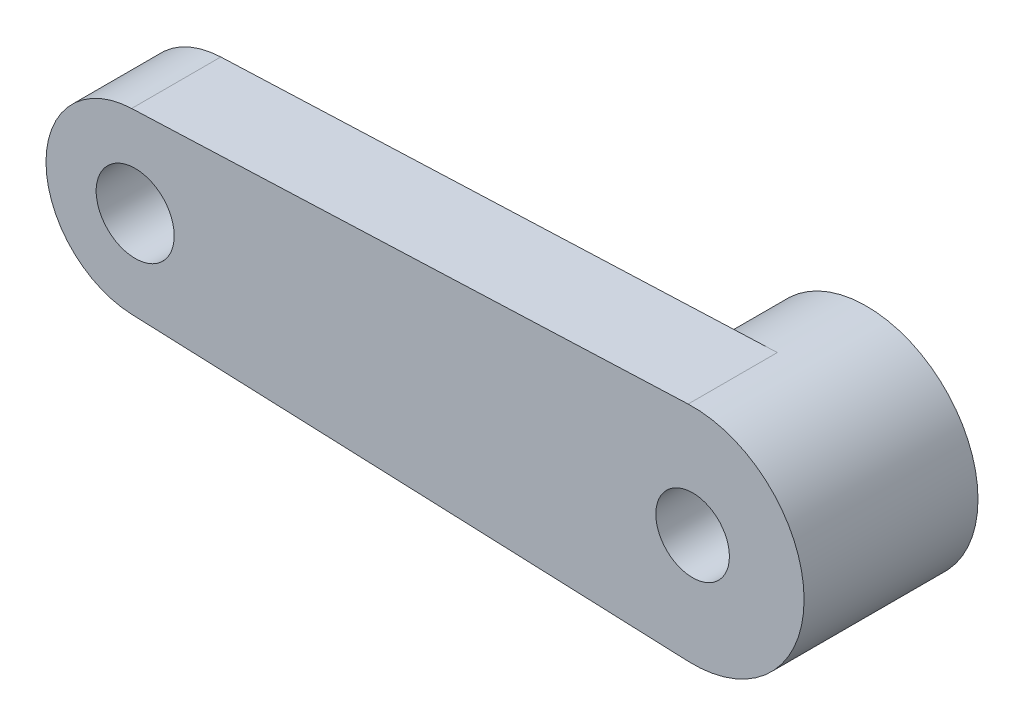
from build123d import *
from build123d.topology import SkipClean

# Parameters (mm, degrees)
SKETCH1_R           = 5
BOSS_EXTRUDE1_DEPTH = 3.8
SKETCH2_R           = 1.65
SKETCH2_R_2         = 1.75
BOSS_EXTRUDE2_DEPTH = 4


with BuildPart() as part:
    # Sketch1 → Boss-Extrude1 (new body)
    with BuildSketch(Plane.XY):
        Circle(SKETCH1_R)
        with BuildLine():
            Line((0.230810939, 2.825076686), (0.169592064, 2.745294695))
            Line((0.169592064, 2.745294695), (0.121151994, 2.829195356))
            ThreePointArc((0.121151994, 2.829195356), (-0.003908933, 2.911590561), (-0.137917489, 2.844725679))
            Line((-0.137917489, 2.844725679), (-0.190155863, 2.75424616))
            Line((-0.190155863, 2.75424616), (-0.251374738, 2.834028151))
            ThreePointArc((-0.251374738, 2.834028151), (-0.389956668, 2.891430666), (-0.508959669, 2.800116452))
            Line((-0.508959669, 2.800116452), (-0.547443463, 2.707208355))
            Line((-0.547443463, 2.707208355), (-0.618552241, 2.778317134))
            ThreePointArc((-0.618552241, 2.778317134), (-0.763441115, 2.817139991), (-0.869507132, 2.711073973))
            Line((-0.869507132, 2.711073973), (-0.895534752, 2.613937576))
            Line((-0.895534752, 2.613937576), (-0.975316743, 2.675156451))
            ThreePointArc((-0.975316743, 2.675156451), (-1.124033472, 2.694735379), (-1.215347686, 2.575732378))
            Line((-1.215347686, 2.575732378), (-1.228473792, 2.47602971))
            Line((-1.228473792, 2.47602971), (-1.315563903, 2.526311209))
            ThreePointArc((-1.315563903, 2.526311209), (-1.465563903, 2.526311209), (-1.540563903, 2.396407399))
            Line((-1.540563903, 2.396407399), (-1.540563903, 2.2958444))
            Line((-1.540563903, 2.2958444), (-1.633472, 2.334328193))
            ThreePointArc((-1.633472, 2.334328193), (-1.782188729, 2.314749265), (-1.839591244, 2.176167335))
            Line((-1.839591244, 2.176167335), (-1.826465138, 2.076464666))
            Line((-1.826465138, 2.076464666), (-1.923601536, 2.102492286))
            ThreePointArc((-1.923601536, 2.102492286), (-2.06849041, 2.063669429), (-2.107313267, 1.918780555))
            Line((-2.107313267, 1.918780555), (-2.081285648, 1.821644157))
            Line((-2.081285648, 1.821644157), (-2.180988316, 1.834770262))
            ThreePointArc((-2.180988316, 1.834770262), (-2.319570246, 1.777367747), (-2.339149175, 1.628651018))
            Line((-2.339149175, 1.628651018), (-2.300665381, 1.535742922))
            Line((-2.300665381, 1.535742922), (-2.40122838, 1.535742922))
            ThreePointArc((-2.40122838, 1.535742922), (-2.531132191, 1.460742922), (-2.531132191, 1.310742922))
            Line((-2.531132191, 1.310742922), (-2.480850691, 1.22365281))
            Line((-2.480850691, 1.22365281), (-2.58055336, 1.210526705))
            ThreePointArc((-2.58055336, 1.210526705), (-2.699556361, 1.11921249), (-2.679977432, 0.970495761))
            Line((-2.679977432, 0.970495761), (-2.618758557, 0.89071377))
            Line((-2.618758557, 0.89071377), (-2.715894955, 0.864686151))
            ThreePointArc((-2.715894955, 0.864686151), (-2.821960972, 0.758620134), (-2.783138115, 0.61373126))
            Line((-2.783138115, 0.61373126), (-2.712029337, 0.542622481))
            Line((-2.712029337, 0.542622481), (-2.804937433, 0.504138688))
            ThreePointArc((-2.804937433, 0.504138688), (-2.896251648, 0.385135687), (-2.838849133, 0.246553757))
            Line((-2.838849133, 0.246553757), (-2.759067142, 0.185334882))
            Line((-2.759067142, 0.185334882), (-2.846157253, 0.135053382))
            ThreePointArc((-2.846157253, 0.135053382), (-2.921157253, 0.005149572), (-2.846157253, -0.124754239))
            Line((-2.846157253, -0.124754239), (-2.759067142, -0.175035738))
            Line((-2.759067142, -0.175035738), (-2.838849133, -0.236254613))
            ThreePointArc((-2.838849133, -0.236254613), (-2.896251648, -0.374836543), (-2.804937433, -0.493839544))
            Line((-2.804937433, -0.493839544), (-2.712029337, -0.532323338))
            Line((-2.712029337, -0.532323338), (-2.783138115, -0.603432116))
            ThreePointArc((-2.783138115, -0.603432116), (-2.821960972, -0.74832099), (-2.715894955, -0.854387007))
            Line((-2.715894955, -0.854387007), (-2.618758557, -0.880414626))
            Line((-2.618758557, -0.880414626), (-2.679977432, -0.960196618))
            ThreePointArc((-2.679977432, -0.960196618), (-2.699556361, -1.108913347), (-2.58055336, -1.200227561))
            Line((-2.58055336, -1.200227561), (-2.480850691, -1.213353666))
            Line((-2.480850691, -1.213353666), (-2.531132191, -1.300443778))
            ThreePointArc((-2.531132191, -1.300443778), (-2.531132191, -1.450443778), (-2.40122838, -1.525443778))
            Line((-2.40122838, -1.525443778), (-2.300665381, -1.525443778))
            Line((-2.300665381, -1.525443778), (-2.339149175, -1.618351875))
            ThreePointArc((-2.339149175, -1.618351875), (-2.319570246, -1.767068604), (-2.180988316, -1.824471119))
            Line((-2.180988316, -1.824471119), (-2.081285648, -1.811345013))
            Line((-2.081285648, -1.811345013), (-2.107313267, -1.908481411))
            ThreePointArc((-2.107313267, -1.908481411), (-2.06849041, -2.053370285), (-1.923601536, -2.092193142))
            Line((-1.923601536, -2.092193142), (-1.826465138, -2.066165522))
            Line((-1.826465138, -2.066165522), (-1.839591244, -2.165868191))
            ThreePointArc((-1.839591244, -2.165868191), (-1.782188729, -2.304450121), (-1.633472, -2.32402905))
            Line((-1.633472, -2.32402905), (-1.540563903, -2.285545256))
            Line((-1.540563903, -2.285545256), (-1.540563903, -2.386108255))
            ThreePointArc((-1.540563903, -2.386108255), (-1.465563903, -2.516012066), (-1.315563903, -2.516012066))
            Line((-1.315563903, -2.516012066), (-1.228473792, -2.465730566))
            Line((-1.228473792, -2.465730566), (-1.215347686, -2.565433235))
            ThreePointArc((-1.215347686, -2.565433235), (-1.124033472, -2.684436236), (-0.975316743, -2.664857307))
            Line((-0.975316743, -2.664857307), (-0.895534752, -2.603638432))
            Line((-0.895534752, -2.603638432), (-0.869507132, -2.70077483))
            ThreePointArc((-0.869507132, -2.70077483), (-0.763441115, -2.806840847), (-0.618552241, -2.76801799))
            Line((-0.618552241, -2.76801799), (-0.547443463, -2.696909212))
            Line((-0.547443463, -2.696909212), (-0.508959669, -2.789817308))
            ThreePointArc((-0.508959669, -2.789817308), (-0.389956668, -2.881131522), (-0.251374738, -2.823729008))
            Line((-0.251374738, -2.823729008), (-0.190155863, -2.743947016))
            Line((-0.190155863, -2.743947016), (-0.139874364, -2.831037128))
            ThreePointArc((-0.139874364, -2.831037128), (-0.009970553, -2.906037128), (0.119933257, -2.831037128))
            Line((0.119933257, -2.831037128), (0.170214757, -2.743947016))
            Line((0.170214757, -2.743947016), (0.231433632, -2.823729008))
            ThreePointArc((0.231433632, -2.823729008), (0.370015562, -2.881131522), (0.489018563, -2.789817308))
            Line((0.489018563, -2.789817308), (0.527502356, -2.696909212))
            Line((0.527502356, -2.696909212), (0.598611135, -2.76801799))
            ThreePointArc((0.598611135, -2.76801799), (0.743500009, -2.806840847), (0.849566026, -2.70077483))
            Line((0.849566026, -2.70077483), (0.875593645, -2.603638432))
            Line((0.875593645, -2.603638432), (0.955375636, -2.664857307))
            ThreePointArc((0.955375636, -2.664857307), (1.104092365, -2.684436236), (1.19540658, -2.565433235))
            Line((1.19540658, -2.565433235), (1.208532685, -2.465730566))
            Line((1.208532685, -2.465730566), (1.295622797, -2.516012066))
            ThreePointArc((1.295622797, -2.516012066), (1.445622797, -2.516012066), (1.520622797, -2.386108255))
            Line((1.520622797, -2.386108255), (1.520622797, -2.285545256))
            Line((1.520622797, -2.285545256), (1.613530893, -2.32402905))
            ThreePointArc((1.613530893, -2.32402905), (1.762247622, -2.304450121), (1.819650137, -2.165868191))
            Line((1.819650137, -2.165868191), (1.806524032, -2.066165522))
            Line((1.806524032, -2.066165522), (1.90366043, -2.092193142))
            ThreePointArc((1.90366043, -2.092193142), (2.048549304, -2.053370285), (2.08737216, -1.908481411))
            Line((2.08737216, -1.908481411), (2.061344541, -1.811345013))
            Line((2.061344541, -1.811345013), (2.16104721, -1.824471119))
            ThreePointArc((2.16104721, -1.824471119), (2.299629139, -1.767068604), (2.319208068, -1.618351875))
            Line((2.319208068, -1.618351875), (2.280724275, -1.525443778))
            Line((2.280724275, -1.525443778), (2.381287274, -1.525443778))
            ThreePointArc((2.381287274, -1.525443778), (2.511191084, -1.450443778), (2.511191084, -1.300443778))
            Line((2.511191084, -1.300443778), (2.460909585, -1.213353666))
            Line((2.460909585, -1.213353666), (2.560612253, -1.200227561))
            ThreePointArc((2.560612253, -1.200227561), (2.679615254, -1.108913347), (2.660036325, -0.960196618))
            Line((2.660036325, -0.960196618), (2.598817451, -0.880414626))
            Line((2.598817451, -0.880414626), (2.695953848, -0.854387007))
            ThreePointArc((2.695953848, -0.854387007), (2.802019865, -0.74832099), (2.763197009, -0.603432116))
            Line((2.763197009, -0.603432116), (2.69208823, -0.532323338))
            Line((2.69208823, -0.532323338), (2.784996327, -0.493839544))
            ThreePointArc((2.784996327, -0.493839544), (2.876310541, -0.374836543), (2.818908026, -0.236254613))
            Line((2.818908026, -0.236254613), (2.739126035, -0.175035738))
            Line((2.739126035, -0.175035738), (2.83148471, -0.121712432))
            ThreePointArc((2.83148471, -0.121712432), (2.894400551, 0.001114226), (2.830352473, 0.123354296))
            Line((2.830352473, 0.123354296), (2.738503342, 0.176383417))
            Line((2.738503342, 0.176383417), (2.818285333, 0.237602291))
            ThreePointArc((2.818285333, 0.237602291), (2.875687848, 0.376184221), (2.784373634, 0.495187222))
            Line((2.784373634, 0.495187222), (2.691465537, 0.533671016))
            Line((2.691465537, 0.533671016), (2.762574316, 0.604779794))
            ThreePointArc((2.762574316, 0.604779794), (2.801397173, 0.749668668), (2.695331155, 0.855734686))
            Line((2.695331155, 0.855734686), (2.598194758, 0.881762305))
            Line((2.598194758, 0.881762305), (2.659413632, 0.961544296))
            ThreePointArc((2.659413632, 0.961544296), (2.678992561, 1.110261025), (2.55998956, 1.20157524))
            Line((2.55998956, 1.20157524), (2.460286892, 1.214701345))
            Line((2.460286892, 1.214701345), (2.510568391, 1.301791457))
            ThreePointArc((2.510568391, 1.301791457), (2.510568391, 1.451791457), (2.380664581, 1.526791457))
            Line((2.380664581, 1.526791457), (2.280101582, 1.526791457))
            Line((2.280101582, 1.526791457), (2.318585375, 1.619699553))
            ThreePointArc((2.318585375, 1.619699553), (2.299006446, 1.768416282), (2.160424517, 1.825818797))
            Line((2.160424517, 1.825818797), (2.060721848, 1.812692692))
            Line((2.060721848, 1.812692692), (2.086749467, 1.90982909))
            ThreePointArc((2.086749467, 1.90982909), (2.047926611, 2.054717963), (1.903037737, 2.09354082))
            Line((1.903037737, 2.09354082), (1.805901339, 2.067513201))
            Line((1.805901339, 2.067513201), (1.819027444, 2.167215869))
            ThreePointArc((1.819027444, 2.167215869), (1.761624929, 2.305797799), (1.6129082, 2.325376728))
            Line((1.6129082, 2.325376728), (1.520000104, 2.286892934))
            Line((1.520000104, 2.286892934), (1.520000104, 2.387455933))
            ThreePointArc((1.520000104, 2.387455933), (1.445000104, 2.517359744), (1.295000104, 2.517359744))
            Line((1.295000104, 2.517359744), (1.207909992, 2.467078244))
            Line((1.207909992, 2.467078244), (1.194783887, 2.566780913))
            ThreePointArc((1.194783887, 2.566780913), (1.103469672, 2.685783914), (0.954752943, 2.666204985))
            Line((0.954752943, 2.666204985), (0.874970952, 2.60498611))
            Line((0.874970952, 2.60498611), (0.848943333, 2.702122508))
            ThreePointArc((0.848943333, 2.702122508), (0.742877316, 2.808188525), (0.597988442, 2.769365669))
            Line((0.597988442, 2.769365669), (0.526879663, 2.69825689))
            Line((0.526879663, 2.69825689), (0.48839587, 2.791164986))
            ThreePointArc((0.48839587, 2.791164986), (0.369392869, 2.882479201), (0.230810939, 2.825076686))
        make_face(mode=Mode.SUBTRACT)
    extrude(amount=BOSS_EXTRUDE1_DEPTH)

    # Sketch2 → Boss-Extrude2 (add)
    with SkipClean():  # the faces are left unmerged after this step: merging them gives an invalid solid
        with BuildSketch(Plane.XY.offset(3.8)):
            with BuildLine():
                Line((-25.16, 3.996798719), (-0.2, 4.995998399))
                ThreePointArc((-0.2, 4.995998399), (5, 0), (-0.2, -4.995998399))
                Line((-0.2, -4.995998399), (-25.16, -3.996798719))
                ThreePointArc((-25.16, -3.996798719), (-29, 0), (-25.16, 3.996798719))
            make_face()
            Circle(SKETCH2_R, mode=Mode.SUBTRACT)
            with Locations((-25, 0)):
                Circle(SKETCH2_R_2, mode=Mode.SUBTRACT)
        extrude(amount=BOSS_EXTRUDE2_DEPTH)
    add(part.part.scale(1), mode=Mode.REPLACE)  # the faces are merged on a copy


solid = part.part
